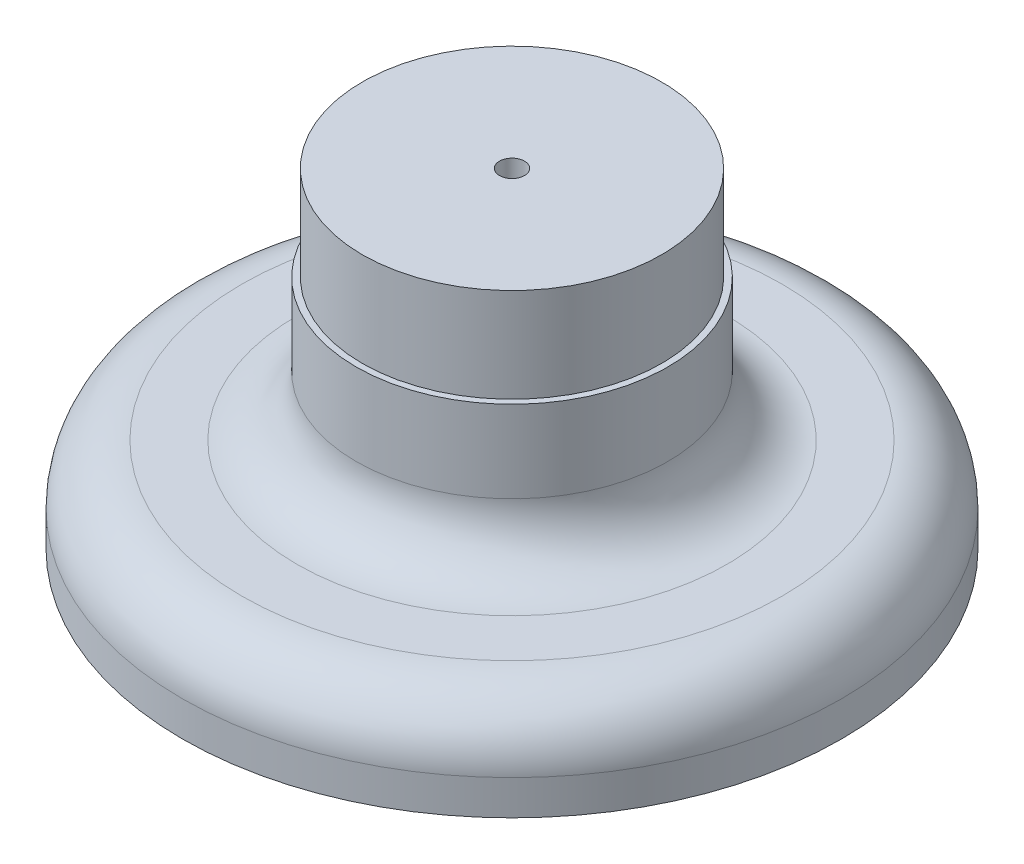
from build123d import *

# Parameters (mm, degrees)
SKETCH1_R                                           = 40.386
BOSS_EXTRUDE1_DEPTH                                 = 88.9
SKETCH1_3_R                                         = 42.037
SKETCH1_3_R_2                                       = 40.386
BOSS_EXTRUDE2_DEPTH                                 = 63.5
SKETCH1_4_R                                         = 88.9
SKETCH1_4_R_2                                       = 42.037
BOSS_EXTRUDE3_DEPTH                                 = 25.4
CSK_FOR_1_4_FLAT_HEAD_MACHINE_SCREW_100_D           = 6.7564
CSK_FOR_1_4_FLAT_HEAD_MACHINE_SCREW_100_CSINK_D     = 12.8778
CSK_FOR_1_4_FLAT_HEAD_MACHINE_SCREW_100_CSINK_ANGLE = 100
FILLET1_R                                           = 16.002
FILLET2_R                                           = 16.002


with BuildPart() as part:
    # Sketch1 → Boss-Extrude1 (new body)
    with BuildSketch(Plane(origin=(0, 0, 0), x_dir=(1, 0, 0), z_dir=(0, 1, 0))):
        Circle(SKETCH1_R)
    extrude(amount=BOSS_EXTRUDE1_DEPTH)

    # Sketch1<3> → Boss-Extrude2 (add)
    with BuildSketch(Plane(origin=(0, 0, 0), x_dir=(1, 0, 0), z_dir=(0, 1, 0))):
        Circle(SKETCH1_3_R)
        Circle(SKETCH1_3_R_2, mode=Mode.SUBTRACT)
    extrude(amount=BOSS_EXTRUDE2_DEPTH)

    # Sketch1<4> → Boss-Extrude3 (add)
    with BuildSketch(Plane(origin=(0, 0, 0), x_dir=(1, 0, 0), z_dir=(0, 1, 0))):
        Circle(SKETCH1_4_R)
        Circle(SKETCH1_4_R_2, mode=Mode.SUBTRACT)
    extrude(amount=BOSS_EXTRUDE3_DEPTH)

    # CSK for 1/4 Flat Head Machine Screw (100)1 (through all)
    with Locations(Plane(origin=(0, 0, 0), x_dir=(-1, 0, 0), z_dir=(0, -1, 0))):
        with Locations((0, 0)):
            CounterSinkHole(CSK_FOR_1_4_FLAT_HEAD_MACHINE_SCREW_100_D / 2, CSK_FOR_1_4_FLAT_HEAD_MACHINE_SCREW_100_CSINK_D / 2, counter_sink_angle=CSK_FOR_1_4_FLAT_HEAD_MACHINE_SCREW_100_CSINK_ANGLE)

    # Fillet1
    fillet1_edges = [part.edges().sort_by_distance(p)[0] for p in [
        (-42.037, 25.4, 0),
    ]]
    fillet(fillet1_edges, radius=FILLET1_R)

    # Fillet2
    fillet2_edges = [part.edges().sort_by_distance(p)[0] for p in [
        (-88.9, 25.4, 0),
    ]]
    fillet(fillet2_edges, radius=FILLET2_R)


solid = part.part
